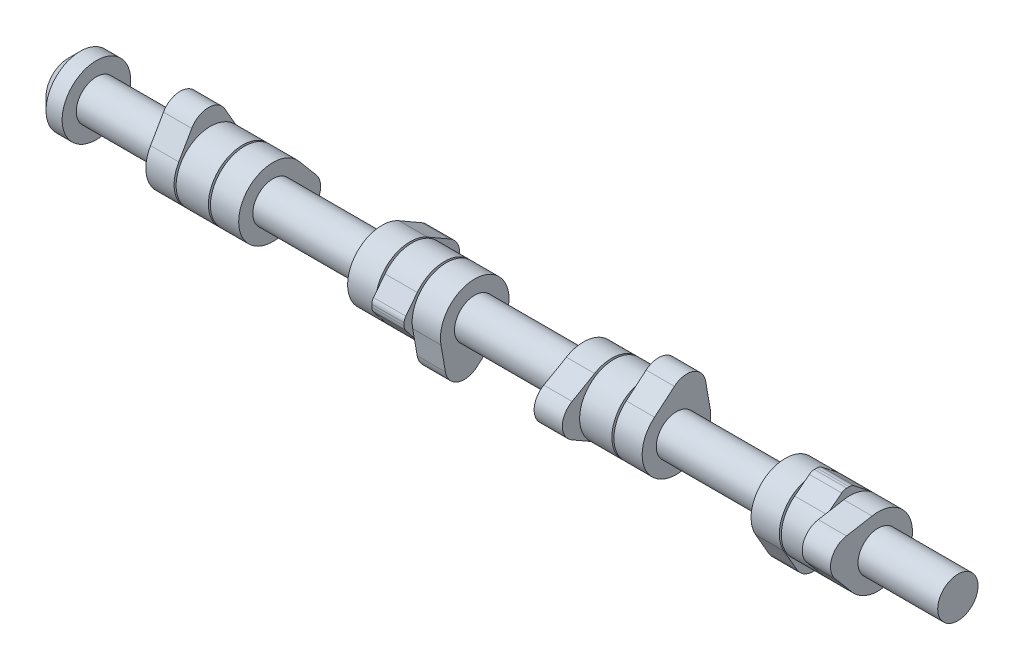
from build123d import *

# Parameters (mm, degrees)
BOSS_EXTRUDE2_DEPTH  = 14
FILLET3_R            = 9.5
FILLET5_R            = 1000
BOSS_EXTRUDE5_DEPTH  = 14
BOSS_EXTRUDE6_DEPTH  = 14
BOSS_EXTRUDE7_DEPTH  = 14
BOSS_EXTRUDE8_DEPTH  = 14
BOSS_EXTRUDE9_DEPTH  = 14
BOSS_EXTRUDE10_DEPTH = 14
BOSS_EXTRUDE11_DEPTH = 14
SKETCH1_6_W          = 16
SKETCH1_6_H          = 7
BOSS_EXTRUDE12_DEPTH = 16
FILLET6_R            = 1000
FILLET7_R            = 4
BOSS_EXTRUDE13_DEPTH = 16
BOSS_EXTRUDE14_DEPTH = 16
BOSS_EXTRUDE15_DEPTH = 16
FRONT_START          = 16
SKETCH22_R           = 17
FRONT_DEPTH          = 16
CHAMFER1_SIZE        = 6
SKETCH23_R           = 6
CUT_EXTRUDE1_DEPTH   = 40
CUT_EXTRUDE2_START   = -2
SKETCH24_R           = 17
SKETCH24_R_2         = 10
CUT_EXTRUDE2_DEPTH   = 2
CUT_EXTRUDE4_DEPTH   = 14
BOSS_EXTRUDE16_DEPTH = 14
CUT_EXTRUDE5_DEPTH   = 14
BOSS_EXTRUDE17_DEPTH = 14
CUT_EXTRUDE6_DEPTH   = 14
BOSS_EXTRUDE18_DEPTH = 14
CUT_EXTRUDE7_DEPTH   = 14
BOSS_EXTRUDE19_DEPTH = 14


# Some blends are built 0.0001 mm under size
with BuildPart() as part:
    # Sketch1 → Revolve1 (revolve)
    with BuildSketch(Plane.XY, mode=Mode.PRIVATE) as revolve1_sk:
        Polygon((10, 0), (0, 0), (0, -10), (425, -10), (425, 0), (415, 0), (385.5, 0), (378.5, 0), (371.5, 0), (370.5, 0), (354.5, 0), (353.5, 0), (346.5, 0), (339.5, 0), (285.5, 0), (278.5, 0), (271.5, 0), (270.5, 0), (254.5, 0), (253.5, 0), (246.5, 0), (239.5, 0), (185.5, 0), (178.5, 0), (171.5, 0), (170.5, 0), (154.5, 0), (153.5, 0), (146.5, 0), (139.5, 0), (85.5, 0), (78.5, 0), (71.5, 0), (70.5, 0), (54.5, 0), (53.5, 0), (46.5, 0), (39.5, 0), align=None)
    revolve(revolve1_sk.sketch.rotate(Axis((0, -10, 0), (1, 0, 0)), 90), axis=Axis((0, -10, 0), (1, 0, 0)))

    # Sketch1<5> → Revolve2 (revolve)
    with BuildSketch(Plane.XY, mode=Mode.PRIVATE) as revolve2_sk:
        Polygon((39.5, 7), (39.5, 0), (46.5, 0), (53.5, 0), (53.5, 7), align=None)
        Polygon((71.5, 7), (71.5, 0), (78.5, 0), (85.5, 0), (85.5, 7), align=None)
        Polygon((139.5, 7), (139.5, 0), (146.5, 0), (153.5, 0), (153.5, 7), align=None)
        Polygon((171.5, 7), (171.5, 0), (178.5, 0), (185.5, 0), (185.5, 7), align=None)
        Polygon((239.5, 7), (239.5, 0), (246.5, 0), (253.5, 0), (253.5, 7), align=None)
        Polygon((278.5, 0), (285.5, 0), (285.5, 7), (271.5, 7), (271.5, 0), align=None)
        Polygon((346.5, 0), (353.5, 0), (353.5, 7), (339.5, 7), (339.5, 0), align=None)
        Polygon((378.5, 0), (385.5, 0), (385.5, 7), (371.5, 7), (371.5, 0), align=None)
    revolve(revolve2_sk.sketch.rotate(Axis((0, -10, 0), (1, 0, 0)), 90), axis=Axis((0, -10, 0), (1, 0, 0)))

    # Sketch2 → Boss-Extrude2 (add)
    with BuildSketch(Plane.ZY.offset(-39.5)):
        with BuildLine():
            Line((0, 15), (0, 7))
            ThreePointArc((0, 7), (6.16158644, 5.844079416), (11.485254692, 2.533512064))
            Line((11.485254692, 2.533512064), (6, 15))
            Line((6, 15), (0, 15))
        make_face()
        with BuildLine():
            ThreePointArc((-11.485254692, 2.533512064), (-6.16158644, 5.844079416), (0, 7))
            Line((0, 7), (0, 15))
            Line((0, 15), (-6, 15))
            Line((-6, 15), (-11.485254692, 2.533512064))
        make_face()
    extrude(amount=-BOSS_EXTRUDE2_DEPTH)

    # Fillet3
    fillet3_edges = [part.edges().sort_by_distance(p)[0] for p in [
        (46.5, 15, 6),
    ]]
    fillet(fillet3_edges, radius=FILLET3_R)
    fillet3_2_edges = [part.edges().sort_by_distance(p)[0] for p in [
        (46.5, 15, -6),
    ]]
    fillet(fillet3_2_edges, radius=FILLET3_R - 0.0001)  # a hair under: the kernel refuses the full size

    # Fillet5
    fillet5_edges = [part.edges().sort_by_distance(p)[0] for p in [
        (46.5, 2.533512064, 11.485254692),
        (46.5, 2.533512064, -11.485254692),
    ]]
    fillet(fillet5_edges, radius=FILLET5_R)

    # Sketch10 → Boss-Extrude5 (add)
    with BuildSketch(Plane.ZY.offset(-71.5)):
        with BuildLine():
            ThreePointArc((-14.683259634, -1.432509905), (0, 7), (14.683259634, -1.432509905))
            ThreePointArc((14.683259634, -1.432509905), (11.456821538, 4.138186943), (8.266311974, 9.729538737))
            ThreePointArc((8.266311974, 9.729538737), (0, 14.547863146), (-8.266311974, 9.729538737))
            ThreePointArc((-8.266311974, 9.729538737), (-11.456821538, 4.138186943), (-14.683259634, -1.432509905))
        make_face()
    extrude(amount=-BOSS_EXTRUDE5_DEPTH)

    # Sketch11 → Boss-Extrude6 (add)
    with BuildSketch(Plane.ZY.offset(-239.5)):
        with BuildLine():
            ThreePointArc((8.567490095, 4.683259634), (14.741901703, -1.533812299), (17, -10))
            ThreePointArc((17, -10), (14.741901703, -18.466187701), (8.567490095, -24.683259634))
            ThreePointArc((8.567490095, -24.683259634), (14.138186943, -21.456821538), (19.729538737, -18.266311974))
            ThreePointArc((19.729538737, -18.266311974), (24.547863146, -10), (19.729538737, -1.733688026))
            ThreePointArc((19.729538737, -1.733688026), (14.138186943, 1.456821538), (8.567490095, 4.683259634))
        make_face()
    extrude(amount=-BOSS_EXTRUDE6_DEPTH)

    # Sketch12 → Boss-Extrude7 (add)
    with BuildSketch(Plane.ZY.offset(-271.5)):
        with BuildLine():
            ThreePointArc((19.729538737, -18.266311974), (24.547863146, -10), (19.729538737, -1.733688026))
            ThreePointArc((19.729538737, -1.733688026), (14.138186943, 1.456821538), (8.567490095, 4.683259634))
            ThreePointArc((8.567490095, 4.683259634), (-17, -10), (8.567490095, -24.683259634))
            ThreePointArc((8.567490095, -24.683259634), (14.138186943, -21.456821538), (19.729538737, -18.266311974))
        make_face()
    extrude(amount=-BOSS_EXTRUDE7_DEPTH)

    # Sketch14 → Boss-Extrude8 (add)
    with BuildSketch(Plane.ZY.offset(-371.5)):
        with BuildLine():
            ThreePointArc((-8.266311974, -29.729538737), (0, -34.547863146), (8.266311974, -29.729538737))
            ThreePointArc((8.266311974, -29.729538737), (11.456821538, -24.138186943), (14.683259634, -18.567490095))
            ThreePointArc((14.683259634, -18.567490095), (0, 7), (-14.683259634, -18.567490095))
            ThreePointArc((-14.683259634, -18.567490095), (-11.456821538, -24.138186943), (-8.266311974, -29.729538737))
        make_face()
    extrude(amount=-BOSS_EXTRUDE8_DEPTH)

    # Sketch13 → Boss-Extrude9 (add)
    with BuildSketch(Plane.ZY.offset(-339.5)):
        with BuildLine():
            ThreePointArc((-8.266311974, -29.729538737), (0, -34.547863146), (8.266311974, -29.729538737))
            ThreePointArc((8.266311974, -29.729538737), (11.456821538, -24.138186943), (14.683259634, -18.567490095))
            ThreePointArc((14.683259634, -18.567490095), (0, 7), (-14.683259634, -18.567490095))
            ThreePointArc((-14.683259634, -18.567490095), (-11.456821538, -24.138186943), (-8.266311974, -29.729538737))
        make_face()
    extrude(amount=-BOSS_EXTRUDE9_DEPTH)

    # Sketch15 → Boss-Extrude10 (add)
    with BuildSketch(Plane.ZY.offset(-139.5)):
        with BuildLine():
            ThreePointArc((-19.729538737, -1.733688026), (-24.547863146, -10), (-19.729538737, -18.266311974))
            ThreePointArc((-19.729538737, -18.266311974), (-14.138186943, -21.456821538), (-8.567490095, -24.683259634))
            ThreePointArc((-8.567490095, -24.683259634), (17, -10), (-8.567490095, 4.683259634))
            ThreePointArc((-8.567490095, 4.683259634), (-14.138186943, 1.456821538), (-19.729538737, -1.733688026))
        make_face()
    extrude(amount=-BOSS_EXTRUDE10_DEPTH)

    # Sketch16 → Boss-Extrude11 (add)
    with BuildSketch(Plane.ZY.offset(-171.5)):
        with BuildLine():
            ThreePointArc((-19.729538737, -1.733688026), (-24.547863146, -10), (-19.729538737, -18.266311974))
            ThreePointArc((-19.729538737, -18.266311974), (-14.138186943, -21.456821538), (-8.567490095, -24.683259634))
            ThreePointArc((-8.567490095, -24.683259634), (17, -10), (-8.567490095, 4.683259634))
            ThreePointArc((-8.567490095, 4.683259634), (-14.138186943, 1.456821538), (-19.729538737, -1.733688026))
        make_face()
    extrude(amount=-BOSS_EXTRUDE11_DEPTH)

    # Sketch1<6> → Revolve3 (revolve)
    with BuildSketch(Plane.XY, mode=Mode.PRIVATE) as revolve3_sk:
        with Locations((62.5, 3.5)):
            Rectangle(SKETCH1_6_W, SKETCH1_6_H)
        with Locations((162.5, 3.5)):
            Rectangle(SKETCH1_6_W, SKETCH1_6_H)
        with Locations((262.5, 3.5)):
            Rectangle(SKETCH1_6_W, SKETCH1_6_H)
        with Locations((362.5, 3.5)):
            Rectangle(SKETCH1_6_W, SKETCH1_6_H)
    revolve(revolve3_sk.sketch.rotate(Axis((0, -10, 0), (1, 0, 0)), 90), axis=Axis((0, -10, 0), (1, 0, 0)))

    # Sketch17 → Boss-Extrude12 (add)
    with BuildSketch(Plane.ZY.offset(-54.5)):
        Polygon((2, -30), (-2, -30), (-17, -10), (17, -10), align=None)
    extrude(amount=-BOSS_EXTRUDE12_DEPTH)

    # Fillet6
    # the kernel refuses this fillet: 1000 mm, written as the material it adds along each edge
    with BuildSketch(Plane(origin=(70.5, -26.32, -4.76), x_dir=(0, -0.8000000000000175, 0.5999999999999766), z_dir=(-1, 0, 0))) as fillet6_piece_1:
        with BuildLine():
            CenterArc((261.216037906, -966.513429337), FILLET6_R, 104.869364111, 0.609274669)
            ThreePointArc((-5.663055414, -2.783410323), (-2.701251625, -1.656761544), (0, 0))
            Line((0, 0), (4.6, 0))
        make_face()
    extrude(amount=16)
    with BuildSketch(Plane(origin=(70.5, -26.32, 4.76), x_dir=(0, -0.800000000000032, -0.5999999999999576), z_dir=(-1, 0, 0))) as fillet6_piece_2:
        with BuildLine():
            CenterArc((261.216037906, 966.513429337), FILLET6_R, 254.52136122, 0.609274669)
            ThreePointArc((-5.663055414, 2.783410323), (-2.701251625, 1.656761544), (0, 0))
            Line((0, 0), (4.6, 0))
        make_face()
    extrude(amount=16)

    # Fillet7
    fillet7_edges = [part.edges().sort_by_distance(p)[0] for p in [
        (62.5, -30, 2),
        (62.5, -30, -2),
    ]]
    fillet(fillet7_edges, radius=FILLET7_R)

    # Sketch21 → Boss-Extrude13 (add)
    with BuildSketch(Plane.ZY.offset(-354.5)):
        with BuildLine():
            Line((0.614051952, 10), (-0.614051952, 10))
            ThreePointArc((-0.614051952, 10), (-1.922312901, 9.780007049), (-3.086669756, 9.144226645))
            ThreePointArc((-3.086669756, 9.144226645), (-6.7290423, 6.293475446), (-10.384561507, 3.459601863))
            ThreePointArc((-10.384561507, 3.459601863), (0, -27), (10.384561507, 3.459601863))
            ThreePointArc((10.384561507, 3.459601863), (6.7290423, 6.293475446), (3.086669756, 9.144226645))
            ThreePointArc((3.086669756, 9.144226645), (1.922312901, 9.780007049), (0.614051952, 10))
        make_face()
    extrude(amount=-BOSS_EXTRUDE13_DEPTH)

    # Sketch20 → Boss-Extrude14 (add)
    with BuildSketch(Plane.ZY.offset(-254.5)):
        with BuildLine():
            Line((-20, -9.385948048), (-20, -10.614051952))
            ThreePointArc((-20, -10.614051952), (-19.780007049, -11.922312901), (-19.144226645, -13.086669756))
            ThreePointArc((-19.144226645, -13.086669756), (-16.293475446, -16.7290423), (-13.459601863, -20.384561507))
            ThreePointArc((-13.459601863, -20.384561507), (17, -10), (-13.459601863, 0.384561507))
            ThreePointArc((-13.459601863, 0.384561507), (-16.293475446, -3.2709577), (-19.144226645, -6.913330244))
            ThreePointArc((-19.144226645, -6.913330244), (-19.780007049, -8.077687099), (-20, -9.385948048))
        make_face()
    extrude(amount=-BOSS_EXTRUDE14_DEPTH)

    # Sketch19 → Boss-Extrude15 (add)
    with BuildSketch(Plane.ZY.offset(-154.5)):
        with BuildLine():
            Line((20, -10.614051952), (20, -9.385948048))
            ThreePointArc((20, -9.385948048), (19.780007049, -8.077687099), (19.144226645, -6.913330244))
            ThreePointArc((19.144226645, -6.913330244), (16.293475446, -3.2709577), (13.459601863, 0.384561507))
            ThreePointArc((13.459601863, 0.384561507), (-17, -10), (13.459601863, -20.384561507))
            ThreePointArc((13.459601863, -20.384561507), (16.293475446, -16.7290423), (19.144226645, -13.086669756))
            ThreePointArc((19.144226645, -13.086669756), (19.780007049, -11.922312901), (20, -10.614051952))
        make_face()
    extrude(amount=-BOSS_EXTRUDE15_DEPTH)

    # Sketch22 → Front (add)
    with BuildSketch(Plane.ZY.offset(FRONT_START)):
        with Locations((0, -10)):
            Circle(SKETCH22_R)
    extrude(amount=-FRONT_DEPTH)

    # Chamfer1
    chamfer1_edges = [part.edges().sort_by_distance(p)[0] for p in [
        (-16, -10, -17),
    ]]
    chamfer(chamfer1_edges, length=CHAMFER1_SIZE)

    # Sketch23 → Cut-Extrude1 (cut)
    with BuildSketch(Plane.ZY.offset(16)):
        with Locations((0, -10)):
            Circle(SKETCH23_R)
    extrude(amount=-CUT_EXTRUDE1_DEPTH, mode=Mode.SUBTRACT)

    # Sketch24 → Cut-Extrude2 (cut)
    with BuildSketch(Plane(origin=(0, 0, 0), x_dir=(0, 0, -1), z_dir=(1, 0, 0)).offset(CUT_EXTRUDE2_START)):
        with Locations((0, -10)):
            Circle(SKETCH24_R)
        with Locations(Location((0, -10, 0), (0, 0, 180))):
            Circle(SKETCH24_R_2, mode=Mode.SUBTRACT)
    extrude(amount=CUT_EXTRUDE2_DEPTH, mode=Mode.SUBTRACT)

    # Sketch28 → Cut-Extrude4 (cut)
    with BuildSketch(Plane.ZY.offset(-71.5)):
        with BuildLine():
            ThreePointArc((-14.683259634, -1.432509905), (0, -27), (14.683259634, -1.432509905))
            ThreePointArc((14.683259634, -1.432509905), (11.456821538, 4.138186943), (8.266311974, 9.729538737))
            ThreePointArc((8.266311974, 9.729538737), (0, 14.547863146), (-8.266311974, 9.729538737))
            ThreePointArc((-8.266311974, 9.729538737), (-11.456821538, 4.138186943), (-14.683259634, -1.432509905))
        make_face()
    extrude(amount=-CUT_EXTRUDE4_DEPTH, mode=Mode.SUBTRACT)


with BuildPart() as cut_extrude4_piece_1:
    # of the separate pieces the step leaves, piece 1, a body of its own (cut_extrude4_pieces)
    add(part.part.solids().sort_by_distance((85.5, -10, 10))[0])



with BuildPart() as cut_extrude4_piece_2:
    # of the separate pieces the step leaves, piece 2, a body of its own (cut_extrude4_pieces)
    add(part.part.solids().sort_by_distance((-10, -10, 17))[0])


with BuildPart() as cut_extrude4_piece_1_1:
    add(cut_extrude4_piece_1.part)

    add(cut_extrude4_piece_2.part)  # Boss-Extrude16 merges Cut-Extrude4 piece 2
    # Sketch26 → Boss-Extrude16 (add)
    with BuildSketch(Plane.ZY.offset(-71.5)):
        with BuildLine():
            ThreePointArc((-3.028836657, -26.728004917), (15.974774553, -4.185657563), (-13.072777786, 0.867496536))
            ThreePointArc((-13.072777786, 0.867496536), (-17.204013686, -4.069654068), (-21.366947169, -8.980107303))
            ThreePointArc((-21.366947169, -8.980107303), (-23.067445855, -18.395863672), (-15.712456757, -24.51569203))
            ThreePointArc((-15.712456757, -24.51569203), (-9.367086197, -25.601435381), (-3.028836657, -26.728004917))
        make_face()
    extrude(amount=-BOSS_EXTRUDE16_DEPTH)

    # Sketch29 → Cut-Extrude5 (cut)
    with BuildSketch(Plane.ZY.offset(-171.5)):
        with BuildLine():
            ThreePointArc((-8.567490095, -24.683259634), (17, -10), (-8.567490095, 4.683259634))
            ThreePointArc((-8.567490095, 4.683259634), (-14.138186943, 1.456821538), (-19.729538737, -1.733688026))
            ThreePointArc((-19.729538737, -1.733688026), (-24.547863146, -10), (-19.729538737, -18.266311974))
            ThreePointArc((-19.729538737, -18.266311974), (-14.138186943, -21.456821538), (-8.567490095, -24.683259634))
        make_face()
    extrude(amount=-CUT_EXTRUDE5_DEPTH, mode=Mode.SUBTRACT)


with BuildPart() as cut_extrude5_piece_1:
    # of the separate pieces the step leaves, piece 1, a body of its own (cut_extrude5_pieces)
    add(cut_extrude4_piece_1_1.part.solids().sort_by_distance((185.5, -10, 10))[0])



with BuildPart() as cut_extrude5_piece_2:
    # of the separate pieces the step leaves, piece 2, a body of its own (cut_extrude5_pieces)
    add(cut_extrude4_piece_1_1.part.solids().sort_by_distance((71.5, -8.980107303, -21.366947169))[0])


with BuildPart() as cut_extrude5_piece_1_1:
    add(cut_extrude5_piece_1.part)

    add(cut_extrude5_piece_2.part)  # Boss-Extrude17 merges Cut-Extrude5 piece 2
    # Sketch30 → Boss-Extrude17 (add)
    with BuildSketch(Plane.ZY.offset(-171.5)):
        with BuildLine():
            ThreePointArc((16.728004917, -13.028836657), (-5.814342437, 5.974774553), (-10.867496536, -23.072777786))
            ThreePointArc((-10.867496536, -23.072777786), (-5.930345932, -27.204013686), (-1.019892697, -31.366947169))
            ThreePointArc((-1.019892697, -31.366947169), (8.395863672, -33.067445855), (14.51569203, -25.712456757))
            ThreePointArc((14.51569203, -25.712456757), (15.601435381, -19.367086197), (16.728004917, -13.028836657))
        make_face()
    extrude(amount=-BOSS_EXTRUDE17_DEPTH)

    # Sketch31 → Cut-Extrude6 (cut)
    with BuildSketch(Plane.ZY.offset(-271.5)):
        with BuildLine():
            ThreePointArc((8.567490095, 4.683259634), (-17, -10), (8.567490095, -24.683259634))
            ThreePointArc((8.567490095, -24.683259634), (14.138186943, -21.456821538), (19.729538737, -18.266311974))
            ThreePointArc((19.729538737, -18.266311974), (24.547863146, -10), (19.729538737, -1.733688026))
            ThreePointArc((19.729538737, -1.733688026), (14.138186943, 1.456821538), (8.567490095, 4.683259634))
        make_face()
    extrude(amount=-CUT_EXTRUDE6_DEPTH, mode=Mode.SUBTRACT)


with BuildPart() as cut_extrude6_piece_1:
    # of the separate pieces the step leaves, piece 1, a body of its own (cut_extrude6_pieces)
    add(cut_extrude5_piece_1_1.part.solids().sort_by_distance((171.5, -13.028836657, 16.728004917))[0])



with BuildPart() as cut_extrude6_piece_2:
    # of the separate pieces the step leaves, piece 2, a body of its own (cut_extrude6_pieces)
    add(cut_extrude5_piece_1_1.part.solids().sort_by_distance((285.5, -10, 10))[0])


with BuildPart() as cut_extrude6_piece_1_1:
    add(cut_extrude6_piece_1.part)

    add(cut_extrude6_piece_2.part)  # Boss-Extrude18 merges Cut-Extrude6 piece 2
    # Sketch32 → Boss-Extrude18 (add)
    with BuildSketch(Plane.ZY.offset(-271.5)):
        with BuildLine():
            ThreePointArc((-16.728004917, -6.971163343), (5.814342437, -25.974774553), (10.867496536, 3.072777786))
            ThreePointArc((10.867496536, 3.072777786), (5.930345932, 7.204013686), (1.019892697, 11.366947169))
            ThreePointArc((1.019892697, 11.366947169), (-8.395863672, 13.067445855), (-14.51569203, 5.712456757))
            ThreePointArc((-14.51569203, 5.712456757), (-15.601435381, -0.632913803), (-16.728004917, -6.971163343))
        make_face()
    extrude(amount=-BOSS_EXTRUDE18_DEPTH)

    # Sketch33 → Cut-Extrude7 (cut)
    with BuildSketch(Plane.ZY.offset(-371.5)):
        with BuildLine():
            ThreePointArc((14.683259634, -18.567490095), (0, 7), (-14.683259634, -18.567490095))
            ThreePointArc((-14.683259634, -18.567490095), (-11.456821538, -24.138186943), (-8.266311974, -29.729538737))
            ThreePointArc((-8.266311974, -29.729538737), (0, -34.547863146), (8.266311974, -29.729538737))
            ThreePointArc((8.266311974, -29.729538737), (11.456821538, -24.138186943), (14.683259634, -18.567490095))
        make_face()
    extrude(amount=-CUT_EXTRUDE7_DEPTH, mode=Mode.SUBTRACT)


with BuildPart() as cut_extrude7_piece_1:
    # of the separate pieces the step leaves, piece 1, a body of its own (cut_extrude7_pieces)
    add(cut_extrude6_piece_1_1.part.solids().sort_by_distance((271.5, 11.366947169, 1.019892697))[0])



with BuildPart() as cut_extrude7_piece_2:
    # of the separate pieces the step leaves, piece 2, a body of its own (cut_extrude7_pieces)
    add(cut_extrude6_piece_1_1.part.solids().sort_by_distance((385.5, -10, 10))[0])


with BuildPart() as cut_extrude7_piece_1_1:
    add(cut_extrude7_piece_1.part)

    add(cut_extrude7_piece_2.part)  # Boss-Extrude19 merges Cut-Extrude7 piece 2
    # Sketch34 → Boss-Extrude19 (add)
    with BuildSketch(Plane.ZY.offset(-371.5)):
        with BuildLine():
            ThreePointArc((3.028836657, 6.728004917), (-15.974774553, -15.814342437), (13.072777786, -20.867496536))
            ThreePointArc((13.072777786, -20.867496536), (17.204013686, -15.930345932), (21.366947169, -11.019892697))
            ThreePointArc((21.366947169, -11.019892697), (23.067445855, -1.604136328), (15.712456757, 4.51569203))
            ThreePointArc((15.712456757, 4.51569203), (9.367086197, 5.601435381), (3.028836657, 6.728004917))
        make_face()
    extrude(amount=-BOSS_EXTRUDE19_DEPTH)


solid = cut_extrude7_piece_1_1.part
